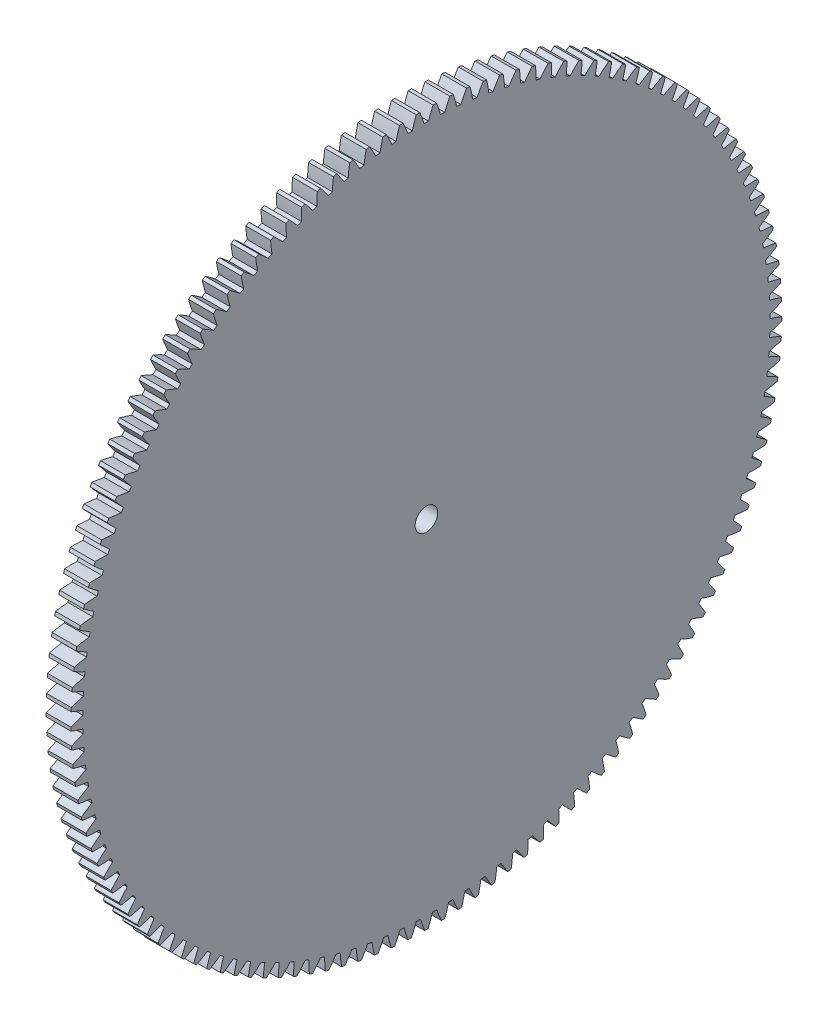
from build123d import *

# Parameters (mm, degrees)
BASPROSKE_W     = 3.3
BASPROSKE_H     = 47.25
TOOTHCUT_DEPTH  = 67.903026837
TEETHCUTS_COUNT = 133
TEETHCUTS_ANGLE = 357.293233083
BORSKE_R        = 1.5
BORE_DEPTH      = 50.0000508


with BuildPart() as part:
    # BasProSke → Base-Revolve (revolve)
    with BuildSketch(Plane(origin=(0, 0, 0), x_dir=(1, 0, 0), z_dir=(0, 1, 0))):
        with Locations((1.65, 23.625)):
            Rectangle(BASPROSKE_W, BASPROSKE_H)
    revolve(axis=Axis((-10, 0, 0), (1, 0, 0)))

    # TooCutSke → ToothCut (cut, through all)
    with BuildSketch(Plane(origin=(0, 0, 0), x_dir=(0, 0, -1), z_dir=(1, 0, 0))):
        with BuildLine():
            ThreePointArc((0.286720096, 45.673100044), (0, 45.674), (-0.286720096, 45.673100044))
            ThreePointArc((-0.286720096, 45.673100044), (-0.570621364, 46.476970179), (-0.891021173, 47.267002512))
            ThreePointArc((-0.891021173, 47.267002512), (0, 47.2754), (0.891021173, 47.267002512))
            ThreePointArc((0.891021173, 47.267002512), (0.570621364, 46.476970179), (0.286720096, 45.673100044))
        make_face()
    toothcut = extrude(amount=TOOTHCUT_DEPTH, mode=Mode.SUBTRACT)

    # TeethCuts: ToothCut ×133 about axis
    teethcuts_axis = Axis((-10, 0, 0), (1, 0, 0))
    for i in range(1, TEETHCUTS_COUNT):
        add(toothcut.rotate(teethcuts_axis, i * TEETHCUTS_ANGLE / (TEETHCUTS_COUNT - 1)), mode=Mode.SUBTRACT)

    # BorSke → Bore (cut, symmetric)
    with BuildSketch(Plane(origin=(0, 0, 0), x_dir=(0, 0, -1), z_dir=(1, 0, 0))):
        Circle(BORSKE_R)
    extrude(amount=BORE_DEPTH, both=True, mode=Mode.SUBTRACT)


solid = part.part
